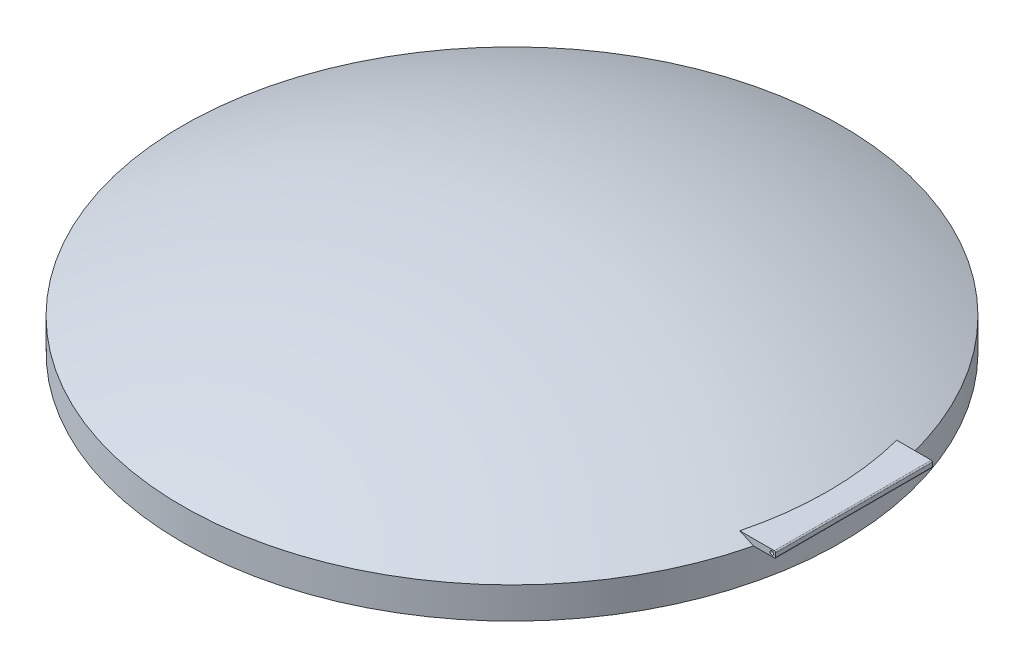
from build123d import *

# Parameters (mm, degrees)
SKETCH1_R                       = 2.625
BOSS_EXTRUDE1_DEPTH             = 0.25
DOME1_FACE_RADIUS               = 2.625
DOME1_HEIGHT                    = 0.6
SKETCH2_W                       = 1.25
SKETCH2_H                       = 0.05
BOSS_EXTRUDE2_DEPTH             = 0.1
BOSS_EXTRUDE2_DIRECTION_2_REACH = 7.931
FILLET1_R                       = 0.01
CUT_EXTRUDE1_REACH              = 6.326
SKETCH3_R                       = 0.015


# Read off the part's stored shape, not the designer's step: Shell1
with BuildPart() as part:
    # Sketch1 → Boss-Extrude1 (new body)
    with BuildSketch(Plane(origin=(0, 0, 0), x_dir=(1, 0, 0), z_dir=(0, 1, 0))):
        with Locations(Location((0, 0, 0), (0, 0, 270))):
            Circle(SKETCH1_R)
    extrude(amount=BOSS_EXTRUDE1_DEPTH)

    # Dome1: a dome of height H over a round flat face of radius A is a cap of a sphere of radius (A * A + H * H) / (2 * H)
    dome1_r = (DOME1_FACE_RADIUS * DOME1_FACE_RADIUS + DOME1_HEIGHT * DOME1_HEIGHT) / (2 * DOME1_HEIGHT)
    dome1_base = Plane((0, 0.25, 0), z_dir=(0, 1, 0))
    with Locations(dome1_base.offset(DOME1_HEIGHT - dome1_r)):
        dome1_ball = Sphere(dome1_r, mode=Mode.PRIVATE)
    add(split(dome1_ball, bisect_by=dome1_base, keep=Keep.TOP, mode=Mode.PRIVATE))

    # Shell1 outline → Shell1 (revolve, cut)
    with BuildSketch(Plane.XY):
        with BuildLine():
            Line((2.525, 0), (2.525000005, 0.186842827))
            ThreePointArc((2.525000005, 0.186842827), (1.293519523, 0.607502106), (0, 0.75))
            Line((0, 0.75), (0, 0))
            Line((0, 0), (2.525, 0))
        make_face()
    revolve(axis=Axis((0, 0, 0), (0, 1, 0)), mode=Mode.SUBTRACT)

    # Sketch2 → Boss-Extrude2 (add)
    with BuildSketch(Plane(origin=(2.625, 0, 0), x_dir=(0, 0, -1), z_dir=(1, 0, 0))):
        with Locations((0, 0.275)):
            Rectangle(SKETCH2_W, SKETCH2_H)
    extrude(amount=BOSS_EXTRUDE2_DEPTH)

    # Sketch2 → Boss-Extrude2 direction 2 (add, up to next)
    with BuildSketch(Plane(origin=(2.625, 0, 0), x_dir=(0, 0, -1), z_dir=(1, 0, 0)), mode=Mode.PRIVATE) as boss_extrude2_direction_2_sk1:
        with Locations((0, 0.275)):
            Rectangle(SKETCH2_W, SKETCH2_H)
    boss_extrude2_direction_2_tool1 = extrude(boss_extrude2_direction_2_sk1.sketch, amount=-BOSS_EXTRUDE2_DIRECTION_2_REACH, mode=Mode.PRIVATE) - part.part
    add(boss_extrude2_direction_2_tool1.solids().sort_by_distance((2.625, 0.275, 0))[0])

    # Fillet1
    fillet1_edges = [part.edges().sort_by_distance(p)[0] for p in [
        (2.725, 0.25, 0),
        (2.725, 0.3, 0),
    ]]
    fillet(fillet1_edges, radius=FILLET1_R)

    # Sketch3 → Cut-Extrude1 (cut, up to next)
    with BuildSketch(Plane.XY.offset(0.625), mode=Mode.PRIVATE) as cut_extrude1_sk1:
        with Locations((2.695, 0.275)):
            Circle(SKETCH3_R)
    cut_extrude1_tool1 = extrude(cut_extrude1_sk1.sketch, amount=-CUT_EXTRUDE1_REACH, mode=Mode.PRIVATE) & part.part
    add(cut_extrude1_tool1.solids().sort_by_distance((2.695, 0.275, 0.625))[0], mode=Mode.SUBTRACT)


solid = part.part
